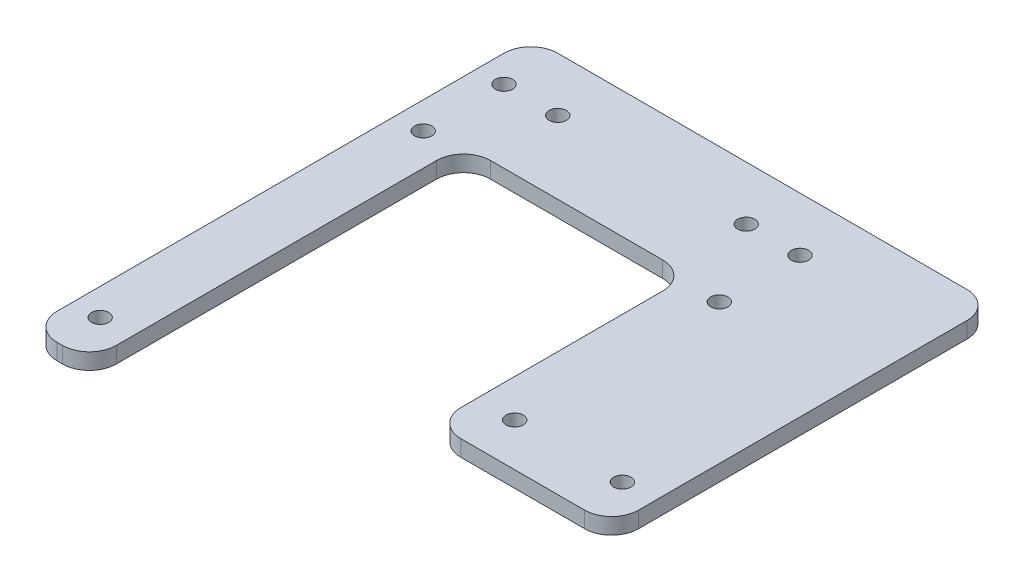
from build123d import *

# Parameters (mm, degrees)
EXTRUDE_1048_DEPTH      = 3
SKETCH_2_R              = 37.5
SKETCH_2_R_2            = 1.6
CUT_EXTRUDE_1713_DEPTH  = 3
SKETCH_8_W              = 65
SKETCH_8_H              = 25
CUT_EXTRUDE_2585_DEPTH  = 3
SKETCH_41_W             = 55
SKETCH_41_H             = 60
CUT_EXTRUDE_2_DEPTH     = 10
SKETCH_10_W             = 65
SKETCH_10_H             = 30
CUT_EXTRUDE_3791_DEPTH  = 3
SKETCH_11_R             = 1.6
SKETCH_11_W             = 42
SKETCH_11_H             = 28
CUT_EXTRUDE_4900_DEPTH  = 3
SKETCH_13_R             = 1.6
CUT_EXTRUDE_5556_DEPTH  = 3
SKETCH_14_R             = 2
CUT_EXTRUDE_5906_DEPTH  = 3
SKETCH_15_R             = 2
CUT_EXTRUDE_6166_DEPTH  = 3
SKETCH_16_R             = 1.6
CUT_EXTRUDE_6673_DEPTH  = 3
SKETCH_19_R             = 2
SKETCH_19_R_2           = 2.5
CUT_EXTRUDE_7839_DEPTH  = 3
SKETCH_21_R             = 1.6
CUT_EXTRUDE_7991_DEPTH  = 3
CUT_EXTRUDE_9_DEPTH     = 10
SKETCH_33_R             = 1.6
PC_DEPTH                = 10
SKETCH_36_R             = 1.6
CUT_EXTRUDE_9334_DEPTH  = 345.206333469
SKETCH_29_R             = 1.6
CUT_EXTRUDE_9716_DEPTH  = 10
SKETCH_39_R             = 1.6
CUT_EXTRUDE_10318_DEPTH = 10
SKETCH_42_W             = 40
SKETCH_42_H             = 40
CUT_EXTRUDE_11_DEPTH    = 10
SKETCH_34_R             = 1.6
UWB_DEPTH               = 10
SKETCH_47_R             = 1.6
CUT_EXTRUDE_13151_DEPTH = 345.206333469
SKETCH_48_R             = 1.6
CUT_EXTRUDE_14_DEPTH    = 345.206333469
CUT_EXTRUDE_6623_DEPTH  = 10
FILLET_13946_R          = 5
FILLET_14545_R          = 2
SKETCH_53_R             = 1.6
RFID_DEPTH              = 10
SKETCH_54_R             = 1.6
CUT_EXTRUDE_19166_DEPTH = 10
SKETCH_55_OUTSIDE_W     = 518.68
SKETCH_55_OUTSIDE_H     = 706.68
CUT_EXTRUDE_17_DEPTH    = 10
FILLET_1_R              = 5
SKETCH_56_R             = 1.6
CUT_EXTRUDE_18_DEPTH    = 10
SKETCH_57_W             = 16
SKETCH_57_H             = 59
CUT_EXTRUDE_19_DEPTH    = 10
SKETCH_58_R             = 1.55
CUT_EXTRUDE_20_DEPTH    = 10
FILLET_2_R              = 2
SKETCH_59_W             = 42
SKETCH_59_H             = 69.5
CUT_EXTRUDE_21_DEPTH    = 10
SKETCH_61_W             = 31.526817686
SKETCH_61_H             = 93
CUT_EXTRUDE_23_DEPTH    = 10
SKETCH_62_W             = 33
SKETCH_62_H             = 22
CUT_EXTRUDE_24_DEPTH    = 10
FILLET_3_R              = 5
SKETCH_63_R             = 1.6
CUT_EXTRUDE_25_DEPTH    = 10


with BuildPart() as part:
    # 草图1 → Extrude 1048 (new body)
    with BuildSketch(Plane(origin=(0, 0, 0), x_dir=(1, 0, 0), z_dir=(0, 1, 0))):
        Polygon((190, 287), (101.545, 287), (79.605689771, 249), (-79.605689771, 249), (-101.545, 287), (-190, 287), (-190, 0), (-190, -281), (-144.091695942, -281), (-98.660254038, -281), (-74.411542732, -239), (74.411542732, -239), (98.660254038, -281), (144.091695942, -281), (190, -281), (190, 0), align=None)
    extrude(amount=EXTRUDE_1048_DEPTH)

    # 草图2 → Cut-Extrude 1713 (cut)
    with BuildSketch(Plane(origin=(0, 3, 0), x_dir=(1, 0, 0), z_dir=(0, 1, 0))):
        Circle(SKETCH_2_R)
        with Locations((38.97114317, 22.5)):
            Circle(SKETCH_2_R_2)
        with Locations((0, -45)):
            Circle(SKETCH_2_R_2)
        with Locations((-38.97114317, 22.5)):
            Circle(SKETCH_2_R_2)
    extrude(amount=-CUT_EXTRUDE_1713_DEPTH, mode=Mode.SUBTRACT)

    # 草图8 → Cut-Extrude 2585 (cut)
    with BuildSketch(Plane(origin=(0, 3, 0), x_dir=(1, 0, 0), z_dir=(0, 1, 0))):
        with Locations((115, -161.5)):
            Rectangle(SKETCH_8_W, SKETCH_8_H)
        with Locations((-115, -161.5)):
            Rectangle(SKETCH_8_W, SKETCH_8_H)
    extrude(amount=-CUT_EXTRUDE_2585_DEPTH, mode=Mode.SUBTRACT)

    # 草图41 → 减重过线孔2 (cut)
    with BuildSketch(Plane(origin=(0, 3, 0), x_dir=(1, 0, 0), z_dir=(0, 1, 0))):
        with Locations((-102.5, 70)):
            Rectangle(SKETCH_41_W, SKETCH_41_H)
        with Locations((102.5, 70)):
            Rectangle(SKETCH_41_W, SKETCH_41_H)
        with Locations((102.5, -70)):
            Rectangle(SKETCH_41_W, SKETCH_41_H)
        with Locations((-102.5, -70)):
            Rectangle(SKETCH_41_W, SKETCH_41_H)
    extrude(amount=-CUT_EXTRUDE_2_DEPTH, mode=Mode.SUBTRACT)

    # 草图10 → Cut-Extrude 3791 (cut)
    with BuildSketch(Plane(origin=(0, 3, 0), x_dir=(1, 0, 0), z_dir=(0, 1, 0))):
        with Locations((-130, 167)):
            Rectangle(SKETCH_10_W, SKETCH_10_H)
        with Locations((130, 167)):
            Rectangle(SKETCH_10_W, SKETCH_10_H)
    extrude(amount=-CUT_EXTRUDE_3791_DEPTH, mode=Mode.SUBTRACT)

    # 草图11 → Cut-Extrude 4900 (cut)
    with BuildSketch(Plane(origin=(0, 3, 0), x_dir=(1, 0, 0), z_dir=(0, 1, 0))):
        with Locations((-153.5, 259)):
            Circle(SKETCH_11_R)
        with Locations((-162.5, 259)):
            Circle(SKETCH_11_R)
        with Locations((-153.5, 209)):
            Circle(SKETCH_11_R)
        with Locations((-162.5, 209)):
            Circle(SKETCH_11_R)
        with Locations((153.5, 259)):
            Circle(SKETCH_11_R)
        with Locations((162.5, 259)):
            Circle(SKETCH_11_R)
        with Locations((153.5, 209)):
            Circle(SKETCH_11_R)
        with Locations((162.5, 209)):
            Circle(SKETCH_11_R)
        with Locations((162.5, -209)):
            Circle(SKETCH_11_R)
        with Locations((153.5, -209)):
            Circle(SKETCH_11_R)
        with Locations((162.5, -259)):
            Circle(SKETCH_11_R)
        with Locations((153.5, -259)):
            Circle(SKETCH_11_R)
        with Locations((-162.5, -209)):
            Circle(SKETCH_11_R)
        with Locations((-153.5, -209)):
            Circle(SKETCH_11_R)
        with Locations((-153.5, -259)):
            Circle(SKETCH_11_R)
        with Locations((-162.5, -259)):
            Circle(SKETCH_11_R)
        with Locations((-158, 234)):
            Rectangle(SKETCH_11_W, SKETCH_11_H)
        with Locations((158, 234)):
            Rectangle(SKETCH_11_W, SKETCH_11_H)
        with Locations((158, -234)):
            Rectangle(SKETCH_11_W, SKETCH_11_H)
        with Locations((-158, -234)):
            Rectangle(SKETCH_11_W, SKETCH_11_H)
    extrude(amount=-CUT_EXTRUDE_4900_DEPTH, mode=Mode.SUBTRACT)

    # 草图13 → Cut-Extrude 5556 (cut)
    with BuildSketch(Plane(origin=(0, 3, 0), x_dir=(1, 0, 0), z_dir=(0, 1, 0))):
        with Locations((25, 176)):
            Circle(SKETCH_13_R)
        with Locations((25, 226)):
            Circle(SKETCH_13_R)
        with Locations((-25, 226)):
            Circle(SKETCH_13_R)
        with Locations((-25, 176)):
            Circle(SKETCH_13_R)
    extrude(amount=-CUT_EXTRUDE_5556_DEPTH, mode=Mode.SUBTRACT)

    # 草图14 → Cut-Extrude 5906 (cut)
    with BuildSketch(Plane(origin=(0, 3, 0), x_dir=(1, 0, 0), z_dir=(0, 1, 0))):
        with Locations((-47.5, 239)):
            Circle(SKETCH_14_R)
        with Locations((-47.5, 214)):
            Circle(SKETCH_14_R)
        with Locations((47.5, 214)):
            Circle(SKETCH_14_R)
        with Locations((47.5, 239)):
            Circle(SKETCH_14_R)
        with Locations((-47.5, -207)):
            Circle(SKETCH_14_R)
        with Locations((-47.5, -232)):
            Circle(SKETCH_14_R)
        with Locations((47.5, -232)):
            Circle(SKETCH_14_R)
        with Locations((47.5, -207)):
            Circle(SKETCH_14_R)
    extrude(amount=-CUT_EXTRUDE_5906_DEPTH, mode=Mode.SUBTRACT)

    # 草图15 → Cut-Extrude 6166 (cut)
    with BuildSketch(Plane(origin=(0, 3, 0), x_dir=(1, 0, 0), z_dir=(0, 1, 0))):
        with Locations((155, 47.5)):
            Circle(SKETCH_15_R)
        with Locations((180, 47.5)):
            Circle(SKETCH_15_R)
        with Locations((180, -47.5)):
            Circle(SKETCH_15_R)
        with Locations((155, -47.5)):
            Circle(SKETCH_15_R)
        with Locations((-155, -47.5)):
            Circle(SKETCH_15_R)
        with Locations((-180, -47.5)):
            Circle(SKETCH_15_R)
        with Locations((-180, 47.5)):
            Circle(SKETCH_15_R)
        with Locations((-155, 47.5)):
            Circle(SKETCH_15_R)
    extrude(amount=-CUT_EXTRUDE_6166_DEPTH, mode=Mode.SUBTRACT)

    # 草图16 → Cut-Extrude 6673 (cut)
    with BuildSketch(Plane(origin=(0, 3, 0), x_dir=(1, 0, 0), z_dir=(0, 1, 0))):
        with Locations((-64, 229)):
            Circle(SKETCH_16_R)
        with Locations((-64, 117)):
            Circle(SKETCH_16_R)
        with Locations((-64, 5)):
            Circle(SKETCH_16_R)
        with Locations((-64, -107)):
            Circle(SKETCH_16_R)
        with Locations((-64, -219)):
            Circle(SKETCH_16_R)
        with Locations((64, 229)):
            Circle(SKETCH_16_R)
        with Locations((64, -107)):
            Circle(SKETCH_16_R)
        with Locations((64, 5)):
            Circle(SKETCH_16_R)
        with Locations((64, 117)):
            Circle(SKETCH_16_R)
        with Locations((64, -219)):
            Circle(SKETCH_16_R)
    extrude(amount=-CUT_EXTRUDE_6673_DEPTH, mode=Mode.SUBTRACT)

    # 草图19 → Cut-Extrude 7839 (cut)
    with BuildSketch(Plane(origin=(0, 3, 0), x_dir=(1, 0, 0), z_dir=(0, 1, 0))):
        with Locations((-177.5, -78)):
            Circle(SKETCH_19_R)
        with Locations((-177.5, -94)):
            Circle(SKETCH_19_R_2)
        with Locations((-177.5, 94)):
            Circle(SKETCH_19_R_2)
        with Locations((-177.5, 78)):
            Circle(SKETCH_19_R)
        with Locations((177.5, -94)):
            Circle(SKETCH_19_R_2)
        with Locations((177.5, -78)):
            Circle(SKETCH_19_R)
        with Locations((177.5, 78)):
            Circle(SKETCH_19_R)
        with Locations((177.5, 94)):
            Circle(SKETCH_19_R_2)
    extrude(amount=-CUT_EXTRUDE_7839_DEPTH, mode=Mode.SUBTRACT)

    # 草图21 → Cut-Extrude 7991 (cut)
    with BuildSketch(Plane(origin=(0, 3, 0), x_dir=(1, 0, 0), z_dir=(0, 1, 0))):
        with Locations((0, -93)):
            Circle(SKETCH_21_R)
    extrude(amount=-CUT_EXTRUDE_7991_DEPTH, mode=Mode.SUBTRACT)

    # 草图32 → 切除-拉伸9 (cut)
    with BuildSketch(Plane(origin=(0, 3, 0), x_dir=(1, 0, 0), z_dir=(0, 1, 0))):
        with BuildLine():
            Line((-34.5, -190), (34.5, -190))
            ThreePointArc((34.5, -190), (36.621320344, -189.121320344), (37.5, -187))
            Line((37.5, -187), (37.5, -133))
            ThreePointArc((37.5, -133), (36.621320344, -130.878679656), (34.5, -130))
            Line((34.5, -130), (-34.5, -130))
            ThreePointArc((-34.5, -130), (-36.621320344, -130.878679656), (-37.5, -133))
            Line((-37.5, -133), (-37.5, -187))
            ThreePointArc((-37.5, -187), (-36.621320344, -189.121320344), (-34.5, -190))
        make_face()
    extrude(amount=-CUT_EXTRUDE_9_DEPTH, mode=Mode.SUBTRACT)

    # 草图33 → PC座固定孔 (cut)
    with BuildSketch(Plane(origin=(0, 3, 0), x_dir=(1, 0, 0), z_dir=(0, 1, 0))):
        with Locations((-42.5, -120.5)):
            Circle(SKETCH_33_R)
        with Locations((42.5, -120.5)):
            Circle(SKETCH_33_R)
    extrude(amount=-PC_DEPTH, mode=Mode.SUBTRACT)

    # 草图36 → Cut-Extrude 9334 (cut, through all)
    with BuildSketch(Plane(origin=(0, 3, 0), x_dir=(1, 0, 0), z_dir=(0, 1, 0))):
        with Locations((-80, -231)):
            Circle(SKETCH_36_R)
        with Locations((-80, -219)):
            Circle(SKETCH_36_R)
        with Locations((80, -219)):
            Circle(SKETCH_36_R)
        with Locations((80, -231)):
            Circle(SKETCH_36_R)
        with Locations((-80, 241)):
            Circle(SKETCH_36_R)
        with Locations((-80, 229)):
            Circle(SKETCH_36_R)
        with Locations((80, 229)):
            Circle(SKETCH_36_R)
        with Locations((80, 241)):
            Circle(SKETCH_36_R)
    extrude(amount=-CUT_EXTRUDE_9334_DEPTH, mode=Mode.SUBTRACT)

    # 草图29 → Cut-Extrude 9716 (cut)
    with BuildSketch(Plane(origin=(0, 3, 0), x_dir=(1, 0, 0), z_dir=(0, 1, 0))):
        with Locations((48, 120)):
            Circle(SKETCH_29_R)
        with Locations((0, 86)):
            Circle(SKETCH_29_R)
        with Locations((0, 154)):
            Circle(SKETCH_29_R)
        with Locations((-48, 120)):
            Circle(SKETCH_29_R)
        with BuildLine():
            Line((40, 98), (40, 142))
            ThreePointArc((40, 142), (39.121320344, 144.121320344), (37, 145))
            Line((37, 145), (-37, 145))
            ThreePointArc((-37, 145), (-39.121320344, 144.121320344), (-40, 142))
            Line((-40, 142), (-40, 98))
            ThreePointArc((-40, 98), (-39.121320344, 95.878679656), (-37, 95))
            Line((-37, 95), (37, 95))
            ThreePointArc((37, 95), (39.121320344, 95.878679656), (40, 98))
        make_face()
    extrude(amount=-CUT_EXTRUDE_9716_DEPTH, mode=Mode.SUBTRACT)

    # 草图39 → Cut-Extrude 10318 (cut)
    with BuildSketch(Plane(origin=(0, 3, 0), x_dir=(1, 0, 0), z_dir=(0, 1, 0))):
        with Locations((185, -271)):
            Circle(SKETCH_39_R)
        with Locations((185, -256)):
            Circle(SKETCH_39_R)
        with Locations((130, -256)):
            Circle(SKETCH_39_R)
        with Locations((130, -271)):
            Circle(SKETCH_39_R)
        with Locations((-130, -271)):
            Circle(SKETCH_39_R)
        with Locations((-130, -256)):
            Circle(SKETCH_39_R)
        with Locations((-185, -256)):
            Circle(SKETCH_39_R)
        with Locations((-185, -271)):
            Circle(SKETCH_39_R)
        with Locations((-130, 262)):
            Circle(SKETCH_39_R)
        with Locations((-130, 277)):
            Circle(SKETCH_39_R)
        with Locations((185, 262)):
            Circle(SKETCH_39_R)
        with Locations((185, 277)):
            Circle(SKETCH_39_R)
        with Locations((-185, 277)):
            Circle(SKETCH_39_R)
        with Locations((-185, 262)):
            Circle(SKETCH_39_R)
        with Locations((130, 277)):
            Circle(SKETCH_39_R)
        with Locations((130, 262)):
            Circle(SKETCH_39_R)
    extrude(amount=-CUT_EXTRUDE_10318_DEPTH, mode=Mode.SUBTRACT)

    # 草图42 → 切除-拉伸11 (cut)
    with BuildSketch(Plane(origin=(0, 3, 0), x_dir=(1, 0, 0), z_dir=(0, 1, 0))):
        with Locations((0, 201)):
            Rectangle(SKETCH_42_W, SKETCH_42_H)
    extrude(amount=-CUT_EXTRUDE_11_DEPTH, mode=Mode.SUBTRACT)

    # 草图34 → UWB固定孔 (cut)
    with BuildSketch(Plane(origin=(0, 3, 0), x_dir=(1, 0, 0), z_dir=(0, 1, 0))):
        with Locations((90, 168)):
            Circle(SKETCH_34_R)
        with Locations((71, 187)):
            Circle(SKETCH_34_R)
        with Locations((90, 206)):
            Circle(SKETCH_34_R)
        with Locations((109, 187)):
            Circle(SKETCH_34_R)
    extrude(amount=-UWB_DEPTH, mode=Mode.SUBTRACT)

    # 草图47 → Cut-Extrude 13151 (cut, through all)
    with BuildSketch(Plane(origin=(0, 3, 0), x_dir=(1, 0, 0), z_dir=(0, 1, 0))):
        with Locations((140, 277)):
            Circle(SKETCH_47_R)
        with Locations((185, -271)):
            Circle(SKETCH_47_R)
        with Locations((95, -231)):
            Circle(SKETCH_47_R)
        with Locations((175, -271)):
            Circle(SKETCH_47_R)
        with Locations((140, 213)):
            Circle(SKETCH_47_R)
        with Locations((175, -207)):
            Circle(SKETCH_47_R)
        with Locations((-140, -271)):
            Circle(SKETCH_47_R)
        with Locations((-140, -207)):
            Circle(SKETCH_47_R)
        with Locations((-175, 213)):
            Circle(SKETCH_47_R)
        with Locations((-95, 237)):
            Circle(SKETCH_47_R)
        with Locations((185, 277)):
            Circle(SKETCH_47_R)
        with Locations((175, 277)):
            Circle(SKETCH_47_R)
        with Locations((95, 237)):
            Circle(SKETCH_47_R)
        with Locations((175, 213)):
            Circle(SKETCH_47_R)
        with Locations((-175, 277)):
            Circle(SKETCH_47_R)
        with Locations((-185, 277)):
            Circle(SKETCH_47_R)
        with Locations((140, -207)):
            Circle(SKETCH_47_R)
        with Locations((140, -271)):
            Circle(SKETCH_47_R)
        with Locations((-175, -207)):
            Circle(SKETCH_47_R)
        with Locations((-140, 213)):
            Circle(SKETCH_47_R)
        with Locations((-175, -271)):
            Circle(SKETCH_47_R)
        with Locations((-95, -231)):
            Circle(SKETCH_47_R)
        with Locations((-185, -271)):
            Circle(SKETCH_47_R)
        with Locations((-140, 277)):
            Circle(SKETCH_47_R)
    extrude(amount=-CUT_EXTRUDE_13151_DEPTH, mode=Mode.SUBTRACT)

    # 草图48 → 切除-拉伸14 (cut, through all)
    with BuildSketch(Plane(origin=(0, 3, 0), x_dir=(1, 0, 0), z_dir=(0, 1, 0))):
        with Locations((-44.5, -46)):
            Circle(SKETCH_48_R)
        with Locations((44.5, -46)):
            Circle(SKETCH_48_R)
        with Locations((-9, -196)):
            Circle(SKETCH_48_R)
        with Locations((9, -196)):
            Circle(SKETCH_48_R)
    extrude(amount=-CUT_EXTRUDE_14_DEPTH, mode=Mode.SUBTRACT)

    # 草图51 → 6623电机过线孔 (cut)
    with BuildSketch(Plane(origin=(0, 3, 0), x_dir=(1, 0, 0), z_dir=(0, 1, 0))):
        with BuildLine():
            Line((-20.5, 67.5), (20.5, 67.5))
            ThreePointArc((20.5, 67.5), (21.914213562, 66.914213562), (22.5, 65.5))
            Line((22.5, 65.5), (22.5, 54.5))
            ThreePointArc((22.5, 54.5), (21.914213562, 53.085786438), (20.5, 52.5))
            Line((20.5, 52.5), (-20.5, 52.5))
            ThreePointArc((-20.5, 52.5), (-21.914213562, 53.085786438), (-22.5, 54.5))
            Line((-22.5, 54.5), (-22.5, 65.5))
            ThreePointArc((-22.5, 65.5), (-21.914213562, 66.914213562), (-20.5, 67.5))
        make_face()
    extrude(amount=-CUT_EXTRUDE_6623_DEPTH, mode=Mode.SUBTRACT)

    # Fillet 13946
    fillet_13946_edges = [part.edges().sort_by_distance(p)[0] for p in [
        (-190, 1.5, -287),
        (-101.545, 1.5, -287),
        (-79.605689771, 1.5, -249),
        (79.605689771, 1.5, -249),
        (101.545, 1.5, -287),
        (190, 1.5, -287),
        (190, 1.5, 281),
        (98.660254038, 1.5, 281),
        (74.411542732, 1.5, 239),
        (-74.411542732, 1.5, 239),
        (-98.660254038, 1.5, 281),
        (-190, 1.5, 281),
    ]]
    fillet(fillet_13946_edges, radius=FILLET_13946_R)

    # Fillet 14545
    fillet_14545_edges = [part.edges().sort_by_distance(p)[0] for p in [
        (-147.5, 1.5, 149),
        (-82.5, 1.5, 149),
        (-82.5, 1.5, 174),
        (-147.5, 1.5, 174),
        (82.5, 1.5, 149),
        (147.5, 1.5, 149),
        (147.5, 1.5, 174),
        (82.5, 1.5, 174),
        (-130, 1.5, -100),
        (-75, 1.5, -100),
        (-75, 1.5, -40),
        (-130, 1.5, -40),
        (-130, 1.5, 100),
        (-130, 1.5, 40),
        (-75, 1.5, 40),
        (-75, 1.5, 100),
        (130, 1.5, 100),
        (75, 1.5, 100),
        (75, 1.5, 40),
        (130, 1.5, 40),
        (130, 1.5, -100),
        (130, 1.5, -40),
        (75, 1.5, -40),
        (75, 1.5, -100),
        (-97.5, 1.5, -152),
        (-162.5, 1.5, -152),
        (-162.5, 1.5, -182),
        (-97.5, 1.5, -182),
        (162.5, 1.5, -182),
        (-137, 1.5, -220),
        (-179, 1.5, -220),
        (-179, 1.5, -248),
        (-137, 1.5, -248),
        (-179, 1.5, 220),
        (-137, 1.5, 220),
        (-137, 1.5, 248),
        (179, 1.5, 248),
        (137, 1.5, 248),
        (137, 1.5, 220),
        (179, 1.5, 220),
        (179, 1.5, -248),
        (179, 1.5, -220),
        (137, 1.5, -220),
        (137, 1.5, -248),
        (20, 1.5, -181),
        (-20, 1.5, -181),
        (-20, 1.5, -221),
        (20, 1.5, -221),
        (-179, 1.5, 248),
        (162.5, 1.5, -152),
        (97.5, 1.5, -152),
        (97.5, 1.5, -182),
    ]]
    fillet(fillet_14545_edges, radius=FILLET_14545_R)

    # 草图53 → RFID固定孔 (cut)
    with BuildSketch(Plane(origin=(0, 3, 0), x_dir=(1, 0, 0), z_dir=(0, 1, 0))):
        with Locations((-135, -31)):
            Circle(SKETCH_53_R)
        with Locations((-85, -31)):
            Circle(SKETCH_53_R)
        with Locations((-85, 31)):
            Circle(SKETCH_53_R)
        with Locations((-135, 31)):
            Circle(SKETCH_53_R)
        with Locations((135, 31)):
            Circle(SKETCH_53_R)
        with Locations((85, 31)):
            Circle(SKETCH_53_R)
        with Locations((85, -31)):
            Circle(SKETCH_53_R)
        with Locations((135, -31)):
            Circle(SKETCH_53_R)
    extrude(amount=-RFID_DEPTH, mode=Mode.SUBTRACT)

    # 草图54 → Cut-Extrude 19166 (cut)
    with BuildSketch(Plane.XZ):
        with Locations((-102.122350269, -278)):
            Circle(SKETCH_54_R)
        with Locations((-92.122350269, -260.679491924)):
            Circle(SKETCH_54_R)
        with Locations((92.122350269, -260.679491924)):
            Circle(SKETCH_54_R)
        with Locations((102.122350269, -278)):
            Circle(SKETCH_54_R)
        with Locations((102.122350269, 272)):
            Circle(SKETCH_54_R)
        with Locations((92.122350269, 254.679491924)):
            Circle(SKETCH_54_R)
        with Locations((-92.122350269, 254.679491924)):
            Circle(SKETCH_54_R)
        with Locations((-102.122350269, 272)):
            Circle(SKETCH_54_R)
    extrude(amount=-CUT_EXTRUDE_19166_DEPTH, mode=Mode.SUBTRACT)

    # 草图55 outside → 切除-拉伸17 (cut)
    with BuildSketch(Plane.XZ):
        with Locations((0, -3)):
            Rectangle(SKETCH_55_OUTSIDE_W, SKETCH_55_OUTSIDE_H)
        with BuildLine():
            Line((-190, -194), (-125, -194))
            Line((-125, -194), (-87, -230))
            Line((-87, -230), (-87, -261.807321004))
            Line((-87, -261.807321004), (-100.101624327, -284.5))
            ThreePointArc((-100.101624327, -284.5), (-101.931751346, -286.330127019), (-104.431751346, -287))
            Line((-104.431751346, -287), (-185, -287))
            ThreePointArc((-185, -287), (-188.535533906, -285.535533906), (-190, -282))
            Line((-190, -282), (-190, -194))
        make_face(mode=Mode.SUBTRACT)
    extrude(amount=-CUT_EXTRUDE_17_DEPTH, mode=Mode.SUBTRACT)

    # 圆角1
    fillet_1_edges = [part.edges().sort_by_distance(p)[0] for p in [
        (-190, 1.5, -194),
        (-87, 1.5, -261.807321004),
        (-87, 1.5, -230),
        (-125, 1.5, -194),
    ]]
    fillet(fillet_1_edges, radius=FILLET_1_R)

    # 草图56 → 切除-拉伸18 (cut)
    with BuildSketch(Plane.XZ):
        with Locations((-185, -202)):
            Circle(SKETCH_56_R)
        with Locations((-131, -202)):
            Circle(SKETCH_56_R)
    extrude(amount=-CUT_EXTRUDE_18_DEPTH, mode=Mode.SUBTRACT)

    # 草图57 → 切除-拉伸19 (cut)
    with BuildSketch(Plane.XZ):
        with Locations((-158, -234)):
            Rectangle(SKETCH_57_W, SKETCH_57_H)
    extrude(amount=-CUT_EXTRUDE_19_DEPTH, mode=Mode.SUBTRACT)

    # 草图58 → 切除-拉伸20 (cut)
    with BuildSketch(Plane.XZ):
        with Locations((-150, -261.95)):
            Circle(SKETCH_58_R)
        with Locations((-166, -261.95)):
            Circle(SKETCH_58_R)
        with Locations((-166, -206.05)):
            Circle(SKETCH_58_R)
        with Locations((-150, -206.05)):
            Circle(SKETCH_58_R)
    extrude(amount=-CUT_EXTRUDE_20_DEPTH, mode=Mode.SUBTRACT)

    # 圆角2
    fillet_2_edges = [part.edges().sort_by_distance(p)[0] for p in [
        (-150, 1.5, -248),
        (-166, 1.5, -248),
        (-150, 1.5, -220),
        (-166, 1.5, -220),
    ]]
    fillet(fillet_2_edges, radius=FILLET_2_R)

    # 草图59 → 切除-拉伸21 (cut)
    with BuildSketch(Plane.XZ):
        with Locations((-158, -228.75)):
            Rectangle(SKETCH_59_W, SKETCH_59_H)
    extrude(amount=-CUT_EXTRUDE_21_DEPTH, mode=Mode.SUBTRACT)

    # 草图61 → 切除-拉伸23 (cut)
    with BuildSketch(Plane.XZ):
        with Locations((-88.236591157, -240.5)):
            Rectangle(SKETCH_61_W, SKETCH_61_H)
    extrude(amount=-CUT_EXTRUDE_23_DEPTH, mode=Mode.SUBTRACT)

    # 草图62 → 切除-拉伸24 (cut)
    with BuildSketch(Plane.XZ):
        with Locations((-120.5, -205)):
            Rectangle(SKETCH_62_W, SKETCH_62_H)
    extrude(amount=-CUT_EXTRUDE_24_DEPTH, mode=Mode.SUBTRACT)

    # 圆角3
    fillet_3_edges = [part.edges().sort_by_distance(p)[0] for p in [
        (-137, 1.5, -263.5),
        (-179, 1.5, -263.5),
    ]]
    fillet(fillet_3_edges, radius=FILLET_3_R)
    fillet_3_2_edges = [part.edges().sort_by_distance(p)[0] for p in [
        (-104, 1.5, -286.981324199),
        (-104, 1.5, -216),
        (-137, 1.5, -216),
        (-179, 1.5, -194),
    ]]
    fillet(fillet_3_2_edges, radius=FILLET_3_R)

    # 草图63 → 切除-拉伸25 (cut)
    with BuildSketch(Plane.XZ):
        with Locations((-130, -224)):
            Circle(SKETCH_63_R)
        with Locations((-110, -224)):
            Circle(SKETCH_63_R)
    extrude(amount=-CUT_EXTRUDE_25_DEPTH, mode=Mode.SUBTRACT)


solid = part.part
